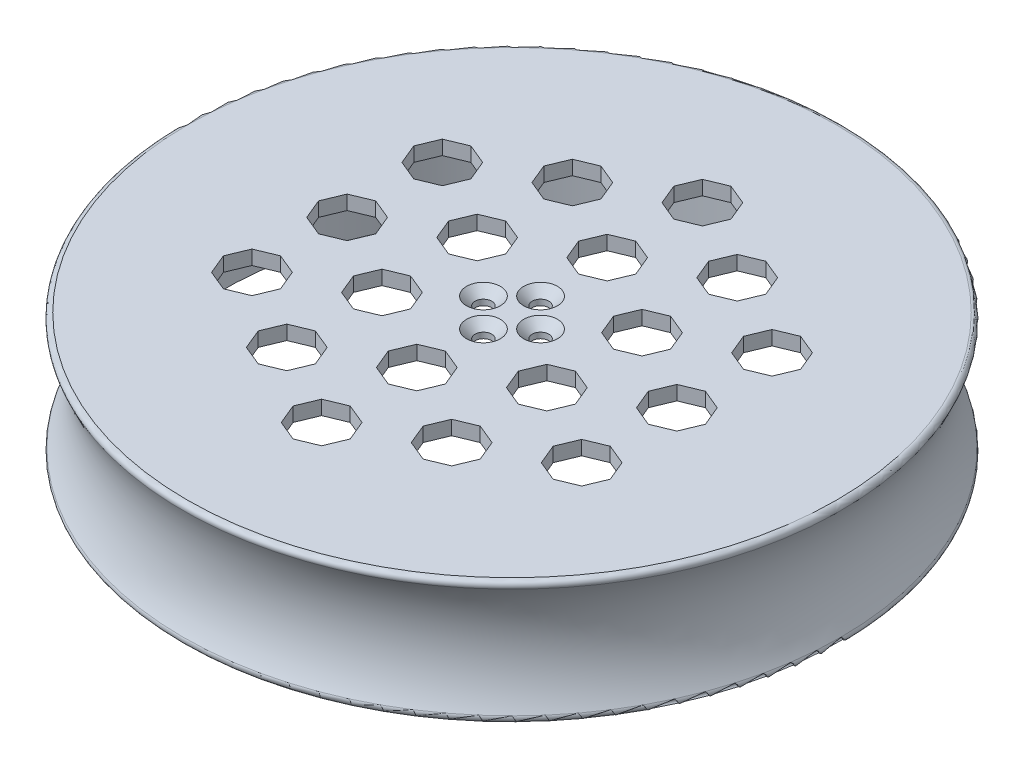
from build123d import *

# Parameters (mm, degrees)
SKETCH2_R           = 70
SKETCH2_R_2         = 60.5
BOSS_EXTRUDE1_DEPTH = 23
SKETCH3_R           = 70
BOSS_EXTRUDE2_DEPTH = 3
SKETCH4_R           = 23.853720884
FILLET1_R           = 1
SKETCH6_R           = 1.75
CUT_EXTRUDE1_DEPTH  = 102.306565772
CHAMFER1_SIZE       = 1.8
FILL_START          = 23
FILL_PATTERN1_DEPTH = 3


# Read off the part's stored shape, not the designer's step: Fill Pattern1
with BuildPart() as part:
    # Sketch2 → Boss-Extrude1 (new body)
    with BuildSketch(Plane(origin=(0, 0, 0), x_dir=(1, 0, 0), z_dir=(0, 1, 0))):
        with Locations(Location((0, 0, 0), (0, 0, 270))):
            Circle(SKETCH2_R)
        with Locations(Location((0, 0, 0), (0, 0, 270))):
            Circle(SKETCH2_R_2, mode=Mode.SUBTRACT)
    extrude(amount=BOSS_EXTRUDE1_DEPTH)

    # Sketch3 → Boss-Extrude2 (add)
    with BuildSketch(Plane(origin=(0, 23, 0), x_dir=(1, 0, 0), z_dir=(0, 1, 0))):
        with Locations(Location((0, 0, 0), (0, 0, 270))):
            Circle(SKETCH3_R)
    extrude(amount=BOSS_EXTRUDE2_DEPTH)

    # Sketch4 → Cut-Revolve1 (revolve, cut)
    with BuildSketch(Plane(origin=(0, 0, 0), x_dir=(0, 0, -1), z_dir=(1, 0, 0)), mode=Mode.PRIVATE) as cut_revolve1_sk:
        with Locations((-90, 13)):
            Circle(SKETCH4_R)
    revolve(cut_revolve1_sk.sketch.rotate(Axis((0, 0, 0), (0, 1, 0)), 180), axis=Axis((0, 0, 0), (0, 1, 0)), mode=Mode.SUBTRACT)

    # Fillet1
    fillet1_edges = [part.edges().sort_by_distance(p)[0] for p in [
        (0, 26, 70),
        (0, 0, 70),
    ]]
    fillet(fillet1_edges, radius=FILLET1_R)

    # Sketch6 → Cut-Extrude1 (cut, through all)
    with BuildSketch(Plane(origin=(0, 26, 0), x_dir=(1, 0, 0), z_dir=(0, 1, 0))):
        with Locations(Location((0, 6, 0), (0, 0, 270))):
            Circle(SKETCH6_R)
        with Locations(Location((6, 0, 0), (0, 0, 270))):
            Circle(SKETCH6_R)
        with Locations(Location((-6, 0, 0), (0, 0, 270))):
            Circle(SKETCH6_R)
        with Locations(Location((0, -6, 0), (0, 0, 270))):
            Circle(SKETCH6_R)
    extrude(amount=-CUT_EXTRUDE1_DEPTH, mode=Mode.SUBTRACT)

    # Chamfer1
    chamfer1_edges = [part.edges().sort_by_distance(p)[0] for p in [
        (0, 26, -7.75),
        (6, 26, -1.75),
        (-6, 26, -1.75),
        (0, 26, 4.25),
    ]]
    chamfer(chamfer1_edges, length=CHAMFER1_SIZE)

    # Fill Pattern1 outline → Fill Pattern1 (cut)
    with BuildSketch(Plane(origin=(0, 0, 0), x_dir=(1, 0, 0), z_dir=(0, 1, 0)).offset(FILL_START)):
        Polygon((0, -33.999996626), (-4.242640687, -35.757355939), (-6, -39.999996626), (-4.242640687, -44.242637313), (0, -45.999996626), (4.242640687, -44.242637313), (6, -39.999996626), (4.242640687, -35.757355939), align=None)
        Polygon((-17.320508076, 36.000003374), (-21.563148763, 34.242644061), (-23.320508076, 30.000003374), (-21.563148763, 25.757362687), (-17.320508076, 24.000003374), (-13.077867389, 25.757362687), (-11.320508076, 30.000003374), (-13.077867389, 34.242644061), align=None)
        Polygon((17.320508076, 16.000003374), (13.077867389, 14.242644061), (11.320508076, 10.000003374), (13.077867389, 5.757362687), (17.320508076, 4.000003374), (21.563148763, 5.757362687), (23.320508076, 10.000003374), (21.563148763, 14.242644061), align=None)
        Polygon((17.320508076, -3.999996626), (13.077867389, -5.757355939), (11.320508076, -9.999996626), (13.077867389, -14.242637313), (17.320508076, -15.999996626), (21.563148763, -14.242637313), (23.320508076, -9.999996626), (21.563148763, -5.757355939), align=None)
        Polygon((0, -13.999996626), (-4.242640687, -15.757355939), (-6, -19.999996626), (-4.242640687, -24.242637313), (0, -25.999996626), (4.242640687, -24.242637313), (6, -19.999996626), (4.242640687, -15.757355939), align=None)
        Polygon((-17.320508076, -23.999996626), (-21.563148763, -25.757355939), (-23.320508076, -29.999996626), (-21.563148763, -34.242637313), (-17.320508076, -35.999996626), (-13.077867389, -34.242637313), (-11.320508076, -29.999996626), (-13.077867389, -25.757355939), align=None)
        Polygon((34.641016151, 26.000003374), (30.398375464, 24.242644061), (28.641016151, 20.000003374), (30.398375464, 15.757362687), (34.641016151, 14.000003374), (38.883656838, 15.757362687), (40.641016151, 20.000003374), (38.883656838, 24.242644061), align=None)
        Polygon((34.641016151, 6.000003374), (30.398375464, 4.242644061), (28.641016151, 3.374e-06), (30.398375464, -4.242637313), (34.641016151, -5.999996626), (38.883656838, -4.242637313), (40.641016151, 3.374e-06), (38.883656838, 4.242644061), align=None)
        Polygon((34.641016151, -13.999996626), (30.398375464, -15.757355939), (28.641016151, -19.999996626), (30.398375464, -24.242637313), (34.641016151, -25.999996626), (38.883656838, -24.242637313), (40.641016151, -19.999996626), (38.883656838, -15.757355939), align=None)
        Polygon((17.320508076, -23.999996626), (13.077867389, -25.757355939), (11.320508076, -29.999996626), (13.077867389, -34.242637313), (17.320508076, -35.999996626), (21.563148763, -34.242637313), (23.320508076, -29.999996626), (21.563148763, -25.757355939), align=None)
        Polygon((-34.641016151, 26.000003374), (-38.883656838, 24.242644061), (-40.641016151, 20.000003374), (-38.883656838, 15.757362687), (-34.641016151, 14.000003374), (-30.398375464, 15.757362687), (-28.641016151, 20.000003374), (-30.398375464, 24.242644061), align=None)
        Polygon((-34.641016151, 6.000003374), (-38.883656838, 4.242644061), (-40.641016151, 3.374e-06), (-38.883656838, -4.242637313), (-34.641016151, -5.999996626), (-30.398375464, -4.242637313), (-28.641016151, 3.374e-06), (-30.398375464, 4.242644061), align=None)
        Polygon((0, 46.000003374), (-4.242640687, 44.242644061), (-6, 40.000003374), (-4.242640687, 35.757362687), (0, 34.000003374), (4.242640687, 35.757362687), (6, 40.000003374), (4.242640687, 44.242644061), align=None)
        Polygon((0, 26.000003374), (-4.242640687, 24.242644061), (-6, 20.000003374), (-4.242640687, 15.757362687), (0, 14.000003374), (4.242640687, 15.757362687), (6, 20.000003374), (4.242640687, 24.242644061), align=None)
        Polygon((17.320508076, 36.000003374), (13.077867389, 34.242644061), (11.320508076, 30.000003374), (13.077867389, 25.757362687), (17.320508076, 24.000003374), (21.563148763, 25.757362687), (23.320508076, 30.000003374), (21.563148763, 34.242644061), align=None)
        Polygon((-34.641016151, -13.999996626), (-38.883656838, -15.757355939), (-40.641016151, -19.999996626), (-38.883656838, -24.242637313), (-34.641016151, -25.999996626), (-30.398375464, -24.242637313), (-28.641016151, -19.999996626), (-30.398375464, -15.757355939), align=None)
        Polygon((-17.320508076, -3.999996626), (-21.563148763, -5.757355939), (-23.320508076, -9.999996626), (-21.563148763, -14.242637313), (-17.320508076, -15.999996626), (-13.077867389, -14.242637313), (-11.320508076, -9.999996626), (-13.077867389, -5.757355939), align=None)
        Polygon((-17.320508076, 16.000003374), (-21.563148763, 14.242644061), (-23.320508076, 10.000003374), (-21.563148763, 5.757362687), (-17.320508076, 4.000003374), (-13.077867389, 5.757362687), (-11.320508076, 10.000003374), (-13.077867389, 14.242644061), align=None)
    extrude(amount=FILL_PATTERN1_DEPTH, mode=Mode.SUBTRACT)


solid = part.part
